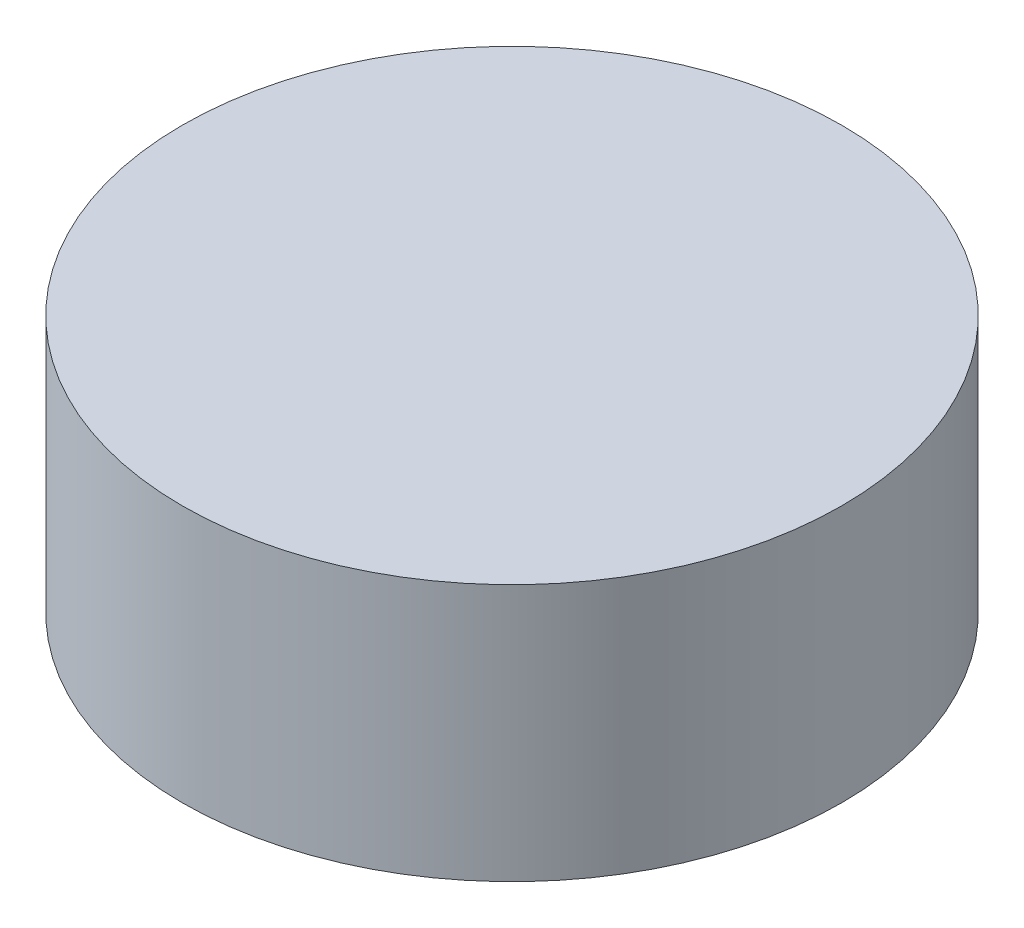
from build123d import *

# Parameters (mm, degrees)
SKETCH1_R           = 19.78
BOSS_EXTRUDE1_DEPTH = 15.43


with BuildPart() as part:
    # Sketch1 → Boss-Extrude1 (new body)
    with BuildSketch(Plane(origin=(0, 0, 0), x_dir=(1, 0, 0), z_dir=(0, 1, 0))):
        Circle(SKETCH1_R)
    extrude(amount=BOSS_EXTRUDE1_DEPTH)


solid = part.part
